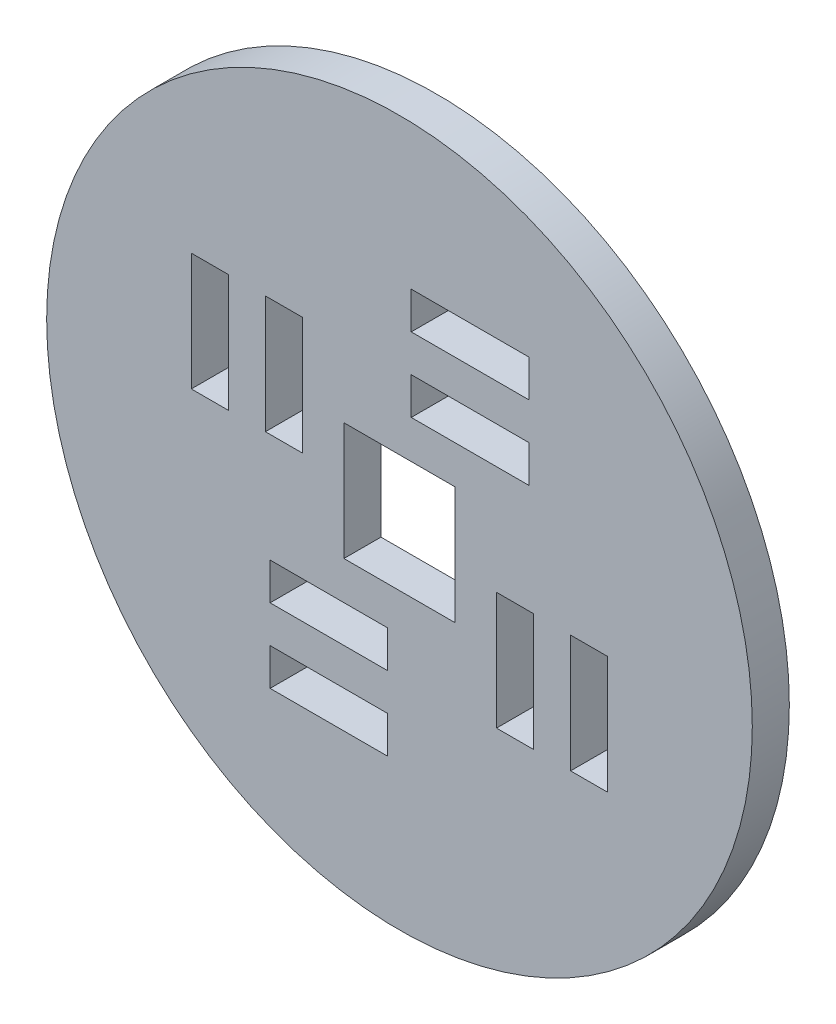
from build123d import *

# Parameters (mm, degrees)
SKETCH1_R           = 38.1
BOSS_EXTRUDE1_DEPTH = 4
SKETCH2_W           = 12.7
SKETCH2_H           = 4
SKETCH2_W_2         = 4
SKETCH2_H_2         = 12.7
CUT_EXTRUDE1_DEPTH  = 55.029806589
CUT_EXTRUDE2_REACH  = 56.03
SKETCH3_W           = 12
SKETCH3_H           = 12.7


with BuildPart() as part:
    # Sketch1 → Boss-Extrude1 (new body)
    with BuildSketch(Plane.XY):
        Circle(SKETCH1_R)
    extrude(amount=BOSS_EXTRUDE1_DEPTH)

    # Sketch2 → Cut-Extrude1 (cut, through all)
    with BuildSketch(Plane.XY.offset(4)):
        with Locations((-7.62, -12.478)):
            Rectangle(SKETCH2_W, SKETCH2_H)
        with Locations((12.478, -7.62)):
            Rectangle(SKETCH2_W_2, SKETCH2_H_2)
        with Locations((20.478, -7.62)):
            Rectangle(SKETCH2_W_2, SKETCH2_H_2)
        with Locations((-7.62, -20.478)):
            Rectangle(SKETCH2_W, SKETCH2_H)
        with Locations((-12.478, 7.62)):
            Rectangle(SKETCH2_W_2, SKETCH2_H_2)
        with Locations((-20.478, 7.62)):
            Rectangle(SKETCH2_W_2, SKETCH2_H_2)
        with Locations((7.62, 12.478)):
            Rectangle(SKETCH2_W, SKETCH2_H)
        with Locations((7.62, 20.478)):
            Rectangle(SKETCH2_W, SKETCH2_H)
    extrude(amount=-CUT_EXTRUDE1_DEPTH, mode=Mode.SUBTRACT)

    # Sketch3 → Cut-Extrude2 (cut, up to next)
    with BuildSketch(Plane.XY.offset(4), mode=Mode.PRIVATE) as cut_extrude2_sk1:
        Rectangle(SKETCH3_W, SKETCH3_H)
    cut_extrude2_tool1 = extrude(cut_extrude2_sk1.sketch, amount=-CUT_EXTRUDE2_REACH, mode=Mode.PRIVATE) & part.part
    add(cut_extrude2_tool1.solids().sort_by_distance((0, 0, 4))[0], mode=Mode.SUBTRACT)


solid = part.part
